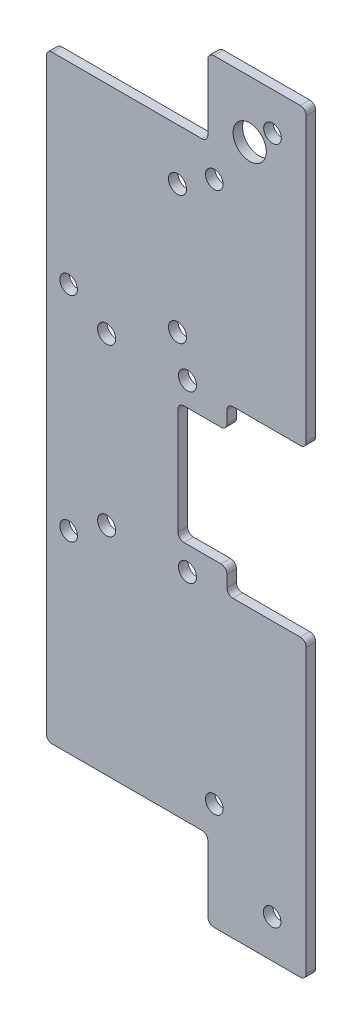
from build123d import *

# Parameters (mm, degrees)
SKETCH1_R               = 2.3495
SKETCH1_R_2             = 4.445
BOSS_EXTRUDE1_DEPTH     = 2.54
SKETCH2_R               = 2.413
CUT_EXTRUDE1_DEPTH      = 217.884748371
SKETCH3_W               = 13.08488816
SKETCH3_H               = 31.623
CUT_EXTRUDE2_DEPTH      = 217.884748371
SKETCH4_W               = 12.77569874
SKETCH4_H               = 24.435209008
SKETCH4_W_2             = 40.233428475
SKETCH4_H_2             = 28.333759116
CUT_EXTRUDE3_DEPTH      = 217.884748371
SKETCH5_R               = 2.413
CUT_EXTRUDE4_DEPTH      = 217.884748371
CUT_EXTRUDE5_DEPTH      = 217.884748371
CUT_EXTRUDE5_DEPTH_BACK = 217.884748371
SKETCH8_R               = 2.3495
CUT_EXTRUDE6_DEPTH      = 182.669089456
FILLET1_R               = 1.5875
SKETCH9_W               = 0.38488816
SKETCH9_H               = 2.54
CUT_EXTRUDE7_DEPTH      = 152.146866512


with BuildPart() as part:
    # Sketch1 → Boss-Extrude1 (new body)
    with BuildSketch(Plane.XY):
        Polygon((-2.930050059, -104.509781075), (-3.314938219, -104.509781075), (-3.314938219, -110.859781075), (-3.314938219, -123.559781075), (-2.930050059, -123.559781075), (-2.930050059, -168.708281075), (38.709428475, -168.708281075), (38.709428475, -189.536281075), (105.397061781, -189.536281075), (66.517436481, -110.859781075), (45.329949941, -110.859781075), (45.329949941, -104.509781075), (45.329949941, -72.886781075), (45.329949941, -66.536781075), (66.517436481, -66.536781075), (105.397061781, 12.139718925), (38.709428475, 12.139718925), (38.709428475, -8.688281075), (-2.930050059, -8.688281075), (-2.930050059, -53.836781075), (-3.314938219, -53.836781075), (-3.314938219, -66.536781075), (-3.314938219, -72.886781075), (-2.930050059, -72.886781075), align=None)
        with Locations((90.673911143, 2.614718925)):
            Circle(SKETCH1_R, mode=Mode.SUBTRACT)
        with Locations((41.95655448, -16.435281075)):
            Circle(SKETCH1_R, mode=Mode.SUBTRACT)
        with Locations((3.035061781, -60.186781075)):
            Circle(SKETCH1_R, mode=Mode.SUBTRACT)
        with Locations((3.035061781, -117.209781075)):
            Circle(SKETCH1_R, mode=Mode.SUBTRACT)
        with Locations((41.95655448, -160.961281075)):
            Circle(SKETCH1_R, mode=Mode.SUBTRACT)
        with Locations((90.673911143, -180.011281075)):
            Circle(SKETCH1_R, mode=Mode.SUBTRACT)
        with Locations((51.409428475, -3.100281075)):
            Circle(SKETCH1_R_2, mode=Mode.SUBTRACT)
    extrude(amount=BOSS_EXTRUDE1_DEPTH)

    # Sketch2 → Cut-Extrude1 (cut, through all)
    with BuildSketch(Plane.XY.offset(2.54)):
        with Locations((13.195061781, -66.536781075)):
            Circle(SKETCH2_R)
        with Locations((34.785061781, -66.536781075)):
            Circle(SKETCH2_R)
        with Locations((34.785061781, -110.859781075)):
            Circle(SKETCH2_R)
        with Locations((13.195061781, -110.859781075)):
            Circle(SKETCH2_R)
    extrude(amount=-CUT_EXTRUDE1_DEPTH, mode=Mode.SUBTRACT)

    # Sketch3 → Cut-Extrude2 (cut, through all)
    with BuildSketch(Plane.XY.offset(2.54)):
        with Locations((38.787505861, -88.698281075)):
            Rectangle(SKETCH3_W, SKETCH3_H)
    extrude(amount=-CUT_EXTRUDE2_DEPTH, mode=Mode.SUBTRACT)

    # Sketch4 → Cut-Extrude3 (cut, through all)
    with BuildSketch(Plane.XY.offset(2.54)):
        with Locations((33.845579105, 3.529323429)):
            Rectangle(SKETCH4_W, SKETCH4_H)
        with Locations((20.116714238, -182.875160633)):
            Rectangle(SKETCH4_W_2, SKETCH4_H_2)
    extrude(amount=-CUT_EXTRUDE3_DEPTH, mode=Mode.SUBTRACT)

    # Sketch5 → Cut-Extrude4 (cut, through all)
    with BuildSketch(Plane(origin=(0, 0, 0), x_dir=(-1, 0, 0), z_dir=(0, 0, -1))):
        with Locations((-32.121949941, -22.404281075)):
            Circle(SKETCH5_R)
        with Locations((-32.121949941, -56.694281075)):
            Circle(SKETCH5_R)
    extrude(amount=-CUT_EXTRUDE4_DEPTH, mode=Mode.SUBTRACT)

    # Sketch7 → Cut-Extrude5 (cut, two sides: drawn at the far end of the back side and taken through both)
    with BuildSketch(Plane.XY.offset(2.54).offset(-CUT_EXTRUDE5_DEPTH_BACK)):
        Polygon((66.517436481, -66.536781075), (66.517436481, 21.52212206), (127.820808625, 21.52212206), (115.78217236, -200.256310461), (66.517436481, -200.256310461), (66.517436481, -110.859781075), align=None)
    extrude(amount=CUT_EXTRUDE5_DEPTH + CUT_EXTRUDE5_DEPTH_BACK, mode=Mode.SUBTRACT)

    # Sketch8 → Cut-Extrude6 (cut, through all)
    with BuildSketch(Plane(origin=(-2.186422913, -156.01790406, 0), x_dir=(0.9999106684671756, -0.013366191885727564, 0), z_dir=(0, 0, -1))):
        with Locations((57.571552198, -158.822157642)):
            Circle(SKETCH8_R)
        with Locations((59.899836143, 22.51767094)):
            Circle(SKETCH8_R)
    extrude(amount=-CUT_EXTRUDE6_DEPTH, mode=Mode.SUBTRACT)

    # Fillet1
    fillet1_edges = [part.edges().sort_by_distance(p)[0] for p in [
        (-2.930050059, -168.708281075, 1.27),
        (40.233428475, -168.708281075, 1.27),
        (40.233428475, -189.536281075, 1.27),
        (66.517436481, -189.536281075, 1.27),
        (66.517436481, -110.859781075, 1.27),
        (45.329949941, -110.859781075, 1.27),
        (45.329949941, -104.509781075, 1.27),
        (32.245061781, -104.509781075, 1.27),
        (32.245061781, -72.886781075, 1.27),
        (45.329949941, -72.886781075, 1.27),
        (45.329949941, -66.536781075, 1.27),
        (66.517436481, -66.536781075, 1.27),
        (66.517436481, 12.139718925, 1.27),
        (40.233428475, 12.139718925, 1.27),
        (40.233428475, -8.688281075, 1.27),
        (-2.930050059, -8.688281075, 1.27),
    ]]
    fillet(fillet1_edges, radius=FILLET1_R)

    # Sketch9 → Cut-Extrude7 (cut, through all)
    with BuildSketch(Plane.XZ.offset(123.559781075)):
        with Locations((-3.122494139, 1.27)):
            Rectangle(SKETCH9_W, SKETCH9_H)
    extrude(amount=-CUT_EXTRUDE7_DEPTH, mode=Mode.SUBTRACT)


solid = part.part
